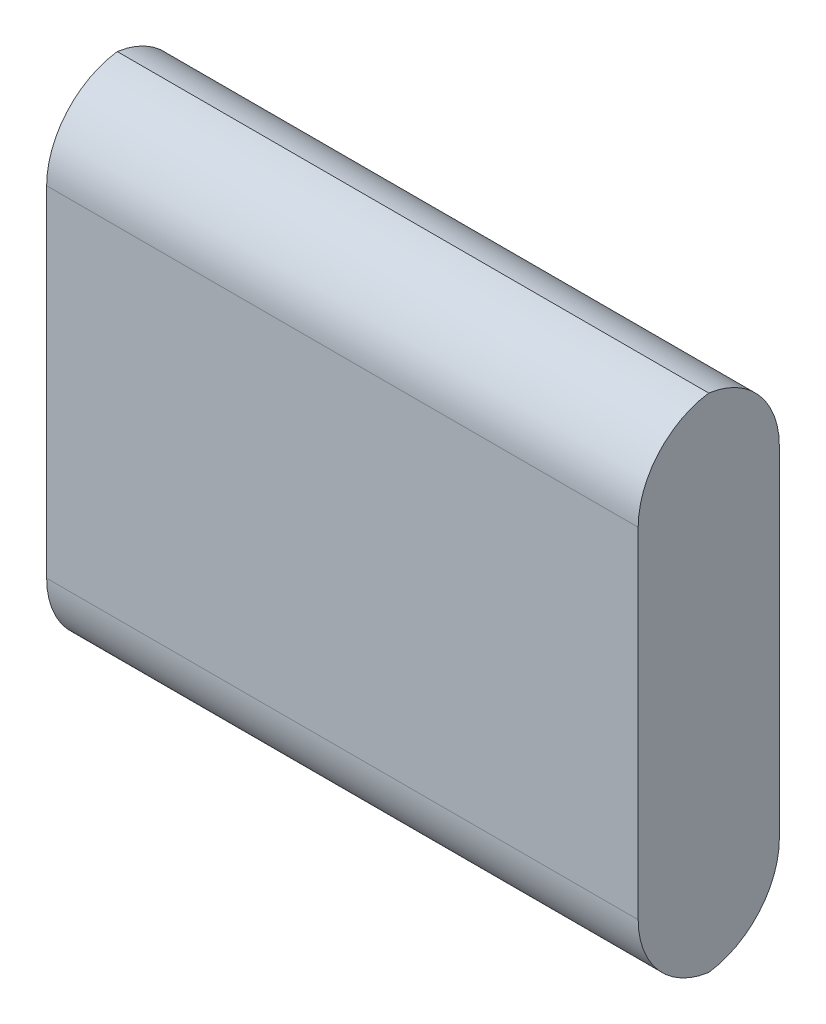
from build123d import *

# Parameters (mm, degrees)
SKETCH_1_W      = 90.5
SKETCH_1_H      = 77
EXTRUDE_1_DEPTH = 21.6
FILLET_1_R      = 12.5


with BuildPart() as part:
    # 草圖1 → 填料-伸長1 (new body)
    with BuildSketch(Plane.XY):
        Rectangle(SKETCH_1_W, SKETCH_1_H)
    extrude(amount=EXTRUDE_1_DEPTH)

    # 圓角1
    # the kernel refuses this fillet: 12.5 mm, written as the material it takes off along each edge
    with BuildSketch(Plane(origin=(-76.5, -38.5, 0), x_dir=(0, 0, 1), z_dir=(1, 0, 0)), Plane(origin=(76.5, 38.5, 0), x_dir=(0, 0, 1), z_dir=(-1, 0, 0))) as fillet_1_piece_1:
        with BuildLine():
            CenterArc((FILLET_1_R, -FILLET_1_R), FILLET_1_R, 90, 90)
            Line((0, -FILLET_1_R), (0, 0))
            Line((0, 0), (FILLET_1_R, 0))
        make_face()
    extrude(amount=153, mode=Mode.SUBTRACT)
    with BuildSketch(Plane(origin=(-76.5, -38.5, 21.6), x_dir=(0, 0, -1), z_dir=(1, 0, 0)), Plane(origin=(76.5, 38.5, 21.6), x_dir=(0, 0, -1), z_dir=(-1, 0, 0))) as fillet_1_piece_2:
        with BuildLine():
            CenterArc((FILLET_1_R, FILLET_1_R), FILLET_1_R, 180, 90)
            Line((0, FILLET_1_R), (0, 0))
            Line((0, 0), (FILLET_1_R, 0))
        make_face()
    extrude(amount=153, mode=Mode.SUBTRACT)


solid = part.part
